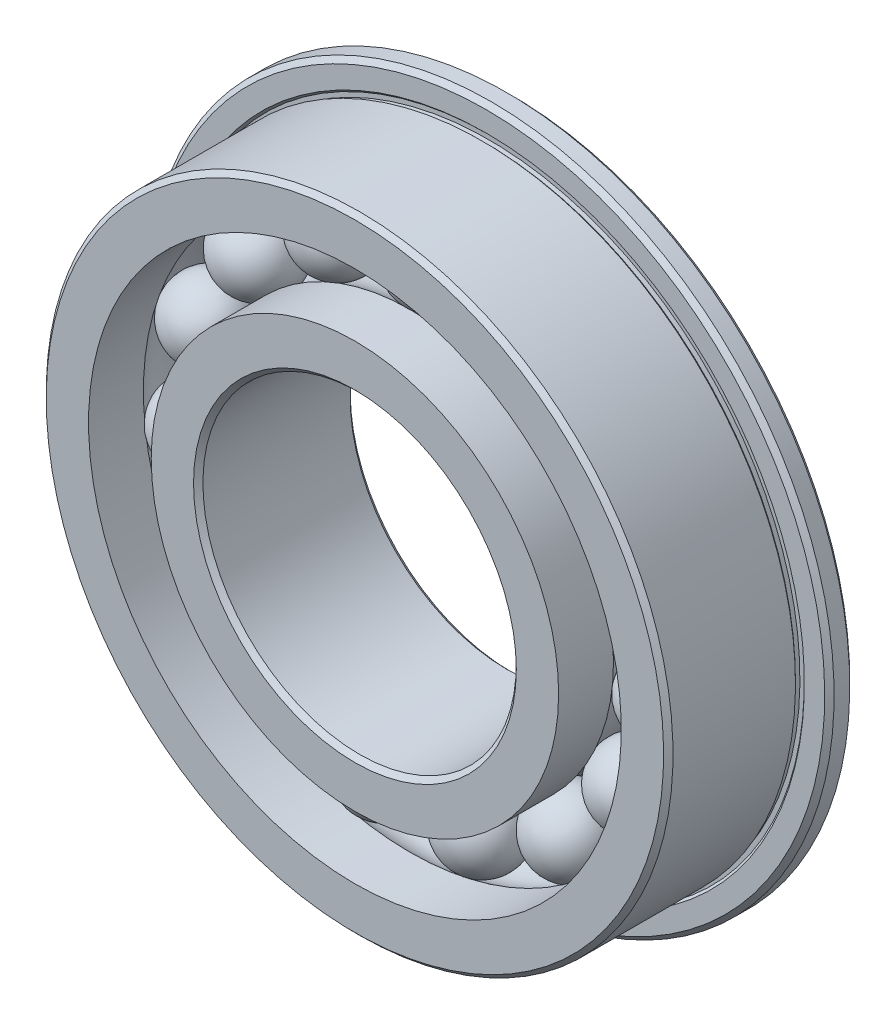
from build123d import *

# Parameters (mm, degrees)
FILLET1_SIZE      = 0.09525
FILLET2_SIZE      = 0.09525
CIRPATTERN3_COUNT = 15


with BuildPart() as part:
    # Sketch2 → Revolve1 (revolve)
    with BuildSketch(Plane(origin=(0, 0, 0), x_dir=(0, 0, -1), z_dir=(1, 0, 0))):
        with BuildLine():
            Line((1.5875, 6.9469), (1.0795, 6.9469))
            Line((1.0795, 6.9469), (1.0795, 6.439802561))
            Line((1.0795, 6.439802561), (1.124401281, 6.394901281))
            Line((1.124401281, 6.394901281), (1.124401281, 6.305098719))
            Line((1.124401281, 6.305098719), (1.034598719, 6.305098719))
            Line((1.034598719, 6.305098719), (0.989697439, 6.35))
            Line((0.989697439, 6.35), (-1.5875, 6.35))
            Line((-1.5875, 6.35), (-1.5875, 5.3975))
            Line((-1.5875, 5.3975), (-0.47625, 5.3975))
            ThreePointArc((-0.47625, 5.3975), (0, 5.55625), (0.47625, 5.3975))
            Line((0.47625, 5.3975), (1.5875, 5.3975))
            Line((1.5875, 5.3975), (1.5875, 6.9469))
        make_face()
        with BuildLine():
            Line((1.5875, 3.175), (-1.5875, 3.175))
            Line((-1.5875, 3.175), (-1.5875, 4.1275))
            Line((-1.5875, 4.1275), (-0.47625, 4.1275))
            ThreePointArc((-0.47625, 4.1275), (0, 3.96875), (0.47625, 4.1275))
            Line((0.47625, 4.1275), (1.5875, 4.1275))
            Line((1.5875, 4.1275), (1.5875, 3.175))
        make_face()
    revolve(axis=Axis((0, 0, 0), (0, 0, -1)))

    # Fillet1
    fillet1_edges = [part.edges().sort_by_distance(p)[0] for p in [
        (0, -6.9469, -1.5875),
        (0, -6.9469, -1.0795),
        (0, -6.35, 1.5875),
    ]]
    chamfer(fillet1_edges, length=FILLET1_SIZE)

    # Fillet2
    fillet2_edges = [part.edges().sort_by_distance(p)[0] for p in [
        (0, -3.175, -1.5875),
        (0, -3.175, 1.5875),
    ]]
    chamfer(fillet2_edges, length=FILLET2_SIZE)


with BuildPart() as body_2:
    # Sketch7 → Revolve3 (revolve)
    with BuildSketch(Plane.XY):
        with BuildLine():
            Line((0, 5.55625), (0, 3.96875))
            ThreePointArc((0, 3.96875), (-0.79375, 4.7625), (0, 5.55625))
        make_face()
    revolve(axis=Axis((0, 5.55625, 0), (0, -1, 0)))


with BuildPart() as cirpattern3_1:
    # CirPattern3: pattern copy
    add(body_2.part.rotate(Axis((0, 0, 0), (0, 0, -1)), 1 * 360 / CIRPATTERN3_COUNT))


with BuildPart() as cirpattern3_2:
    # CirPattern3: pattern copy
    add(body_2.part.rotate(Axis((0, 0, 0), (0, 0, -1)), 2 * 360 / CIRPATTERN3_COUNT))


with BuildPart() as cirpattern3_3:
    # CirPattern3: pattern copy
    add(body_2.part.rotate(Axis((0, 0, 0), (0, 0, -1)), 3 * 360 / CIRPATTERN3_COUNT))


with BuildPart() as cirpattern3_4:
    # CirPattern3: pattern copy
    add(body_2.part.rotate(Axis((0, 0, 0), (0, 0, -1)), 4 * 360 / CIRPATTERN3_COUNT))


with BuildPart() as cirpattern3_5:
    # CirPattern3: pattern copy
    add(body_2.part.rotate(Axis((0, 0, 0), (0, 0, -1)), 5 * 360 / CIRPATTERN3_COUNT))


with BuildPart() as cirpattern3_6:
    # CirPattern3: pattern copy
    add(body_2.part.rotate(Axis((0, 0, 0), (0, 0, -1)), 6 * 360 / CIRPATTERN3_COUNT))


with BuildPart() as cirpattern3_7:
    # CirPattern3: pattern copy
    add(body_2.part.rotate(Axis((0, 0, 0), (0, 0, -1)), 7 * 360 / CIRPATTERN3_COUNT))


with BuildPart() as cirpattern3_8:
    # CirPattern3: pattern copy
    add(body_2.part.rotate(Axis((0, 0, 0), (0, 0, -1)), 8 * 360 / CIRPATTERN3_COUNT))


with BuildPart() as cirpattern3_9:
    # CirPattern3: pattern copy
    add(body_2.part.rotate(Axis((0, 0, 0), (0, 0, -1)), 9 * 360 / CIRPATTERN3_COUNT))


with BuildPart() as cirpattern3_10:
    # CirPattern3: pattern copy
    add(body_2.part.rotate(Axis((0, 0, 0), (0, 0, -1)), 10 * 360 / CIRPATTERN3_COUNT))


with BuildPart() as cirpattern3_11:
    # CirPattern3: pattern copy
    add(body_2.part.rotate(Axis((0, 0, 0), (0, 0, -1)), 11 * 360 / CIRPATTERN3_COUNT))


with BuildPart() as cirpattern3_12:
    # CirPattern3: pattern copy
    add(body_2.part.rotate(Axis((0, 0, 0), (0, 0, -1)), 12 * 360 / CIRPATTERN3_COUNT))


with BuildPart() as cirpattern3_13:
    # CirPattern3: pattern copy
    add(body_2.part.rotate(Axis((0, 0, 0), (0, 0, -1)), 13 * 360 / CIRPATTERN3_COUNT))


with BuildPart() as cirpattern3_14:
    # CirPattern3: pattern copy
    add(body_2.part.rotate(Axis((0, 0, 0), (0, 0, -1)), 14 * 360 / CIRPATTERN3_COUNT))


solid = Compound([part.part, body_2.part, cirpattern3_1.part, cirpattern3_2.part, cirpattern3_3.part, cirpattern3_4.part, cirpattern3_5.part, cirpattern3_6.part, cirpattern3_7.part, cirpattern3_8.part, cirpattern3_9.part, cirpattern3_10.part, cirpattern3_11.part, cirpattern3_12.part, cirpattern3_13.part, cirpattern3_14.part])
